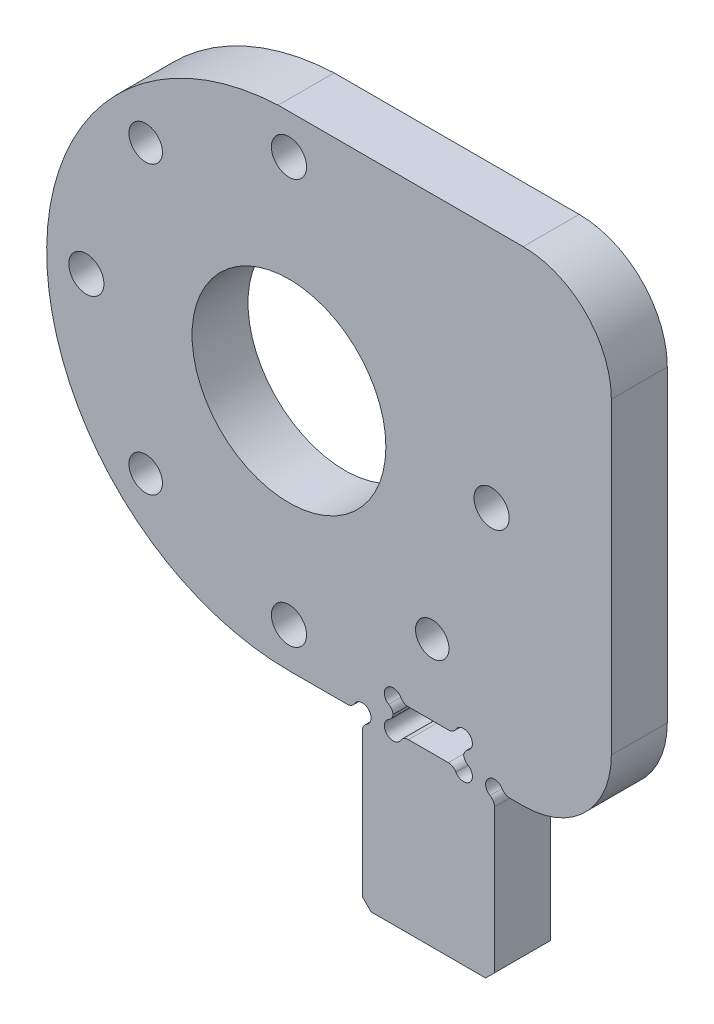
from build123d import *

# Parameters (mm, degrees)
SKETCH1_R           = 11
SKETCH1_R_2         = 1.89865
SKETCH1_R_3         = 1.9939
BOSS_EXTRUDE1_DEPTH = 6.35
FILLET1_R           = 10
SKETCH2_W           = 15
SKETCH2_H           = 19.05
BOSS_EXTRUDE2_DEPTH = 6.35
CHAMFER1_SIZE       = 1
SKETCH3_R           = 1
CUT_EXTRUDE1_DEPTH  = 159.045298363
SKETCH4_W           = 7.99338
SKETCH4_H           = 3.22072
CUT_EXTRUDE2_DEPTH  = 159.045298363
FILLET3_R           = 1
CUT_EXTRUDE3_DEPTH  = 159.045298363
FILLET4_R           = 10
SKETCH9_R           = 1
CUT_EXTRUDE4_DEPTH  = 124.871065449
FILLET5_R           = 1


with BuildPart() as part:
    # Sketch1 → Boss-Extrude1 (new body)
    with BuildSketch(Plane.XY):
        with BuildLine():
            Line((-40.498784978, 0), (0, 0))
            Line((0, 0), (0, 75))
            ThreePointArc((0, 75), (-37.5, 112.5), (-75, 75))
            Line((-75, 75), (-75, 55))
            Line((-75, 55), (-83.323029145, 55))
            ThreePointArc((-83.323029145, 55), (-110.823029145, 27.5), (-83.323029145, 0))
            Line((-83.323029145, 0), (-40.498784978, 0))
        make_face()
        with Locations((-83.323029145, 27.5)):
            Circle(SKETCH1_R, mode=Mode.SUBTRACT)
        with Locations((-67.059573177, 11.236544033)):
            Circle(SKETCH1_R_2, mode=Mode.SUBTRACT)
        with Locations((-83.323029145, 50.5)):
            Circle(SKETCH1_R_3, mode=Mode.SUBTRACT)
        with Locations((-99.586485112, 11.236544033)):
            Circle(SKETCH1_R_2, mode=Mode.SUBTRACT)
        with Locations((-60.323029145, 27.5)):
            Circle(SKETCH1_R_3, mode=Mode.SUBTRACT)
        with Locations((-99.586485112, 43.763455967)):
            Circle(SKETCH1_R_2, mode=Mode.SUBTRACT)
        with Locations((-83.323029145, 4.5)):
            Circle(SKETCH1_R_3, mode=Mode.SUBTRACT)
        with Locations((-106.323029145, 27.5)):
            Circle(SKETCH1_R_3, mode=Mode.SUBTRACT)
    extrude(amount=BOSS_EXTRUDE1_DEPTH)

    # Fillet1
    fillet1_edges = [part.edges().sort_by_distance(p)[0] for p in [
        (-75, 55, 3.175),
    ]]
    fillet(fillet1_edges, radius=FILLET1_R)

    # Sketch2 → Boss-Extrude2 (add)
    with BuildSketch(Plane(origin=(0, 0, 0), x_dir=(-1, 0, 0), z_dir=(0, 0, -1))):
        with Locations((7.5, -9.525)):
            Rectangle(SKETCH2_W, SKETCH2_H)
        with Locations((37.5, -9.525)):
            Rectangle(SKETCH2_W, SKETCH2_H)
        with Locations((67.5, -9.525)):
            Rectangle(SKETCH2_W, SKETCH2_H)
    extrude(amount=-BOSS_EXTRUDE2_DEPTH)

    # Chamfer1
    chamfer1_edges = [part.edges().sort_by_distance(p)[0] for p in [
        (0, -19.05, 3.175),
        (-15, -19.05, 3.175),
        (-30, -19.05, 3.175),
        (-45, -19.05, 3.175),
        (-60, -19.05, 3.175),
        (-75, -19.05, 3.175),
    ]]
    chamfer(chamfer1_edges, length=CHAMFER1_SIZE)

    # Sketch3 → Cut-Extrude1 (cut, through all)
    with BuildSketch(Plane.XY.offset(6.35)):
        with Locations((-75, 0)):
            Circle(SKETCH3_R)
        with Locations((-60, 0)):
            Circle(SKETCH3_R)
        with Locations((-45, 0)):
            Circle(SKETCH3_R)
        with Locations((-30, 0)):
            Circle(SKETCH3_R)
        with Locations((-15, 0)):
            Circle(SKETCH3_R)
    extrude(amount=-CUT_EXTRUDE1_DEPTH, mode=Mode.SUBTRACT)

    # Sketch4 → Cut-Extrude2 (cut, through all)
    with BuildSketch(Plane.XY.offset(6.35)):
        with Locations((-67.5, 1.61036)):
            Rectangle(SKETCH4_W, SKETCH4_H)
    extrude(amount=-CUT_EXTRUDE2_DEPTH, mode=Mode.SUBTRACT)

    # Fillet3
    fillet3_edges = [part.edges().sort_by_distance(p)[0] for p in [
        (-75, -1, 3.175),
        (-76, 0, 3.175),
        (-60, -1, 3.175),
        (-59, 0, 3.175),
        (-45, -1, 3.175),
        (-46, 0, 3.175),
        (-30, -1, 3.175),
        (-29, 0, 3.175),
        (-15, -1, 3.175),
        (-16, 0, 3.175),
    ]]
    fillet(fillet3_edges, radius=FILLET3_R)

    # Sketch5 → Cut-Extrude3 (cut, through all)
    with BuildSketch(Plane(origin=(0, 0, 0), x_dir=(-1, 0, 0), z_dir=(0, 0, -1))):
        Polygon((46.732050808, 0), (46.732050808, 54.972488867), (84.552807772, 54.972488867), (84.552807772, 112.5), (0, 112.5), (0, -19.05), (46.732050808, -19.05), align=None)
    extrude(amount=-CUT_EXTRUDE3_DEPTH, mode=Mode.SUBTRACT)

    # Fillet4
    fillet4_edges = [part.edges().sort_by_distance(p)[0] for p in [
        (-46.732050808, 0, 3.175),
        (-46.732050808, 54.972488867, 3.175),
    ]]
    fillet(fillet4_edges, radius=FILLET4_R)

    # Sketch9 → Cut-Extrude4 (cut, through all)
    with BuildSketch(Plane.XY.offset(6.35)):
        with Locations((-71.49669, 3.22072)):
            Circle(SKETCH9_R)
        with Locations((-63.50331, 3.22072)):
            Circle(SKETCH9_R)
        with Locations((-63.50331, 0)):
            Circle(SKETCH9_R)
        with Locations((-71.49669, 0)):
            Circle(SKETCH9_R)
    extrude(amount=-CUT_EXTRUDE4_DEPTH, mode=Mode.SUBTRACT)

    # Fillet5
    # the kernel refuses this fillet: 1 mm, written as the material it takes off along each edge
    with BuildSketch(Plane(origin=(-64.50331, 3.22072, -1.830127019), x_dir=(0.2588190451025049, 0.9659258262890725, 0), z_dir=(0, 0, 1)), Plane(origin=(-63.50331, 1, -1.830127019), x_dir=(0.9659258262890688, -0.25881904510251885, 0), z_dir=(0, 0, 1)), Plane(origin=(-71.49669, 2.22072, -1.830127019), x_dir=(-0.9659258262890682, 0.25881904510252124, 0), z_dir=(0, 0, 1))) as fillet5_piece_1:
        with BuildLine():
            CenterArc((0.776457135, 0.965925826), FILLET5_R, 195, 60)
            Line((-0.189468691, 0.707106781), (0, 0))
            ThreePointArc((0, 0), (0.258819045, 0.034074174), (0.51763809, 0))
        make_face()
    extrude(amount=10.010254038, mode=Mode.SUBTRACT)
    with BuildSketch(Plane(origin=(-63.50331, 2.22072, -1.830127019), x_dir=(0, -1, 0), z_dir=(0, 0, 1)), Plane(origin=(-71.49669, 1, -1.830127019), x_dir=(0, 1, 0), z_dir=(0, 0, 1))) as fillet5_piece_2:
        with BuildLine():
            CenterArc((0.732050808, 1), FILLET5_R, 210, 60)
            ThreePointArc((-0.133974596, 0.5), (-0.034074174, 0.258819045), (0, 0))
            Line((0, 0), (0.732050808, 0))
        make_face()
    extrude(amount=10.010254038, mode=Mode.SUBTRACT)
    with BuildSketch(Plane(origin=(-64.50331, 0, -1.830127019), x_dir=(0.2588190451025049, -0.9659258262890725, 0), z_dir=(0, 0, 1)), Plane(origin=(-70.49669, 0, 8.180127019), x_dir=(-0.25881904510253045, -0.9659258262890658, 0), z_dir=(0, 0, -1))) as fillet5_piece_3:
        with BuildLine():
            CenterArc((0.776457135, -0.965925826), FILLET5_R, 105, 60)
            Line((-0.189468691, -0.707106781), (0, 0))
            ThreePointArc((0, 0), (0.258819045, -0.034074174), (0.51763809, 0))
        make_face()
    extrude(amount=10.010254038, mode=Mode.SUBTRACT)
    with BuildSketch(Plane(origin=(-70.49669, 3.22072, 8.180127019), x_dir=(1, 0, 0), z_dir=(0, 0, -1))) as fillet5_piece_4:
        with BuildLine():
            CenterArc((0.732050808, -1), FILLET5_R, 90, 60)
            ThreePointArc((-0.133974596, -0.5), (-0.034074174, -0.258819045), (0, 0))
            Line((0, 0), (0.732050808, 0))
        make_face()
    extrude(amount=10.010254038, mode=Mode.SUBTRACT)


solid = part.part
